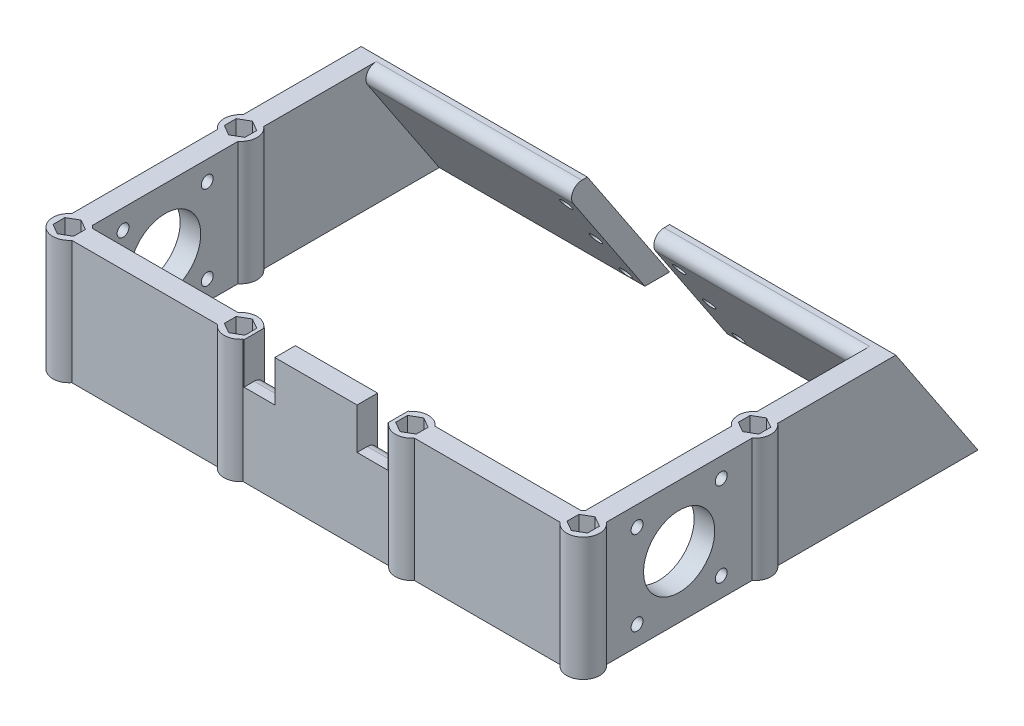
from build123d import *
from OCP.BRepFilletAPI import BRepFilletAPI_MakeChamfer

# Parameters (mm, degrees)
BOSS_EXTRUDE2_DEPTH     = 38.1
CHAMFER2_SIZE           = 38.1
CHAMFER2_SIZE_2         = 25.4
SKETCH6_W               = 9.525
SKETCH6_H               = 12.7
CUT_EXTRUDE3_DEPTH      = 206.929041238
SKETCH7_R               = 10.9855
SKETCH7_R_2             = 1.8415
CUT_EXTRUDE4_DEPTH      = 207.992468583
SKETCH8_W               = 69.85
SKETCH8_H               = 45.790501198
BOSS_EXTRUDE3_DEPTH     = 6.35
CUT_EXTRUDE5_DEPTH      = 208.669669805
CUT_EXTRUDE5_DEPTH_BACK = 208.669669805
BOSS_EXTRUDE4_DEPTH     = 69.85
BOSS_EXTRUDE5_DEPTH     = 69.85
SKETCH12_R              = 1.8288
CUT_EXTRUDE6_DEPTH      = 210.393754689
SKETCH13_R              = 1.8288
CUT_EXTRUDE7_DEPTH      = 12.7
FILLET1_R               = 3.175


with BuildPart() as part:
    # Sketch4 → Boss-Extrude2 (new body)
    with BuildSketch(Plane(origin=(0, 0, 0), x_dir=(1, 0, 0), z_dir=(0, 1, 0))):
        with BuildLine():
            Line((0, 0), (0, -54.242759604))
            ThreePointArc((0, -54.242759604), (-1.905, -58.208333333), (0, -62.173907062))
            Line((0, -62.173907062), (0, -107.159426271))
            ThreePointArc((0, -107.159426271), (-0.417102448, -114.717102448), (7.140573729, -114.3))
            Line((7.140573729, -114.3), (52.126092938, -114.3))
            ThreePointArc((52.126092938, -114.3), (56.091666667, -116.205), (60.057240396, -114.3))
            Line((60.057240396, -114.3), (105.042759604, -114.3))
            ThreePointArc((105.042759604, -114.3), (109.008333333, -116.205), (112.973907062, -114.3))
            Line((112.973907062, -114.3), (157.959426271, -114.3))
            ThreePointArc((157.959426271, -114.3), (165.517102448, -114.717102448), (165.1, -107.159426271))
            Line((165.1, -107.159426271), (165.1, -62.173907062))
            ThreePointArc((165.1, -62.173907062), (167.005, -58.208333333), (165.1, -54.242759604))
            Line((165.1, -54.242759604), (165.1, 0))
            Line((165.1, 0), (158.75, 0))
            Line((158.75, 0), (158.75, -54.242759604))
            ThreePointArc((158.75, -54.242759604), (156.845, -58.208333333), (158.75, -62.173907062))
            Line((158.75, -62.173907062), (158.75, -107.159426271))
            ThreePointArc((158.75, -107.159426271), (158.332897552, -107.532897552), (157.959426271, -107.95))
            Line((157.959426271, -107.95), (112.973907062, -107.95))
            ThreePointArc((112.973907062, -107.95), (109.008333333, -106.045), (105.042759604, -107.95))
            Line((105.042759604, -107.95), (60.057240396, -107.95))
            ThreePointArc((60.057240396, -107.95), (56.091666667, -106.045), (52.126092938, -107.95))
            Line((52.126092938, -107.95), (7.140573729, -107.95))
            ThreePointArc((7.140573729, -107.95), (6.767102448, -107.532897552), (6.35, -107.159426271))
            Line((6.35, -107.159426271), (6.35, -62.173907062))
            ThreePointArc((6.35, -62.173907062), (8.255, -58.208333333), (6.35, -54.242759604))
            Line((6.35, -54.242759604), (6.35, 0))
            Line((6.35, 0), (0, 0))
        make_face()
        Polygon((0, -56.375246229), (0, -60.041420438), (3.175, -61.874507543), (6.35, -60.041420438), (6.35, -56.375246229), (3.175, -54.542159124), align=None, mode=Mode.SUBTRACT)
        Polygon((3.175, -107.458825791), (0, -109.291912895), (0, -112.958087105), (3.175, -114.791174209), (6.35, -112.958087105), (6.35, -109.291912895), align=None, mode=Mode.SUBTRACT)
        Polygon((56.091666667, -107.458825791), (52.916666667, -109.291912895), (52.916666667, -112.958087105), (56.091666667, -114.791174209), (59.266666667, -112.958087105), (59.266666667, -109.291912895), align=None, mode=Mode.SUBTRACT)
        Polygon((109.008333333, -107.458825791), (105.833333333, -109.291912895), (105.833333333, -112.958087105), (109.008333333, -114.791174209), (112.183333333, -112.958087105), (112.183333333, -109.291912895), align=None, mode=Mode.SUBTRACT)
        Polygon((161.925, -107.458825791), (158.75, -109.291912895), (158.75, -112.958087105), (161.925, -114.791174209), (165.1, -112.958087105), (165.1, -109.291912895), align=None, mode=Mode.SUBTRACT)
        Polygon((161.925, -54.542159124), (158.75, -56.375246229), (158.75, -60.041420438), (161.925, -61.874507543), (165.1, -60.041420438), (165.1, -56.375246229), align=None, mode=Mode.SUBTRACT)
    extrude(amount=BOSS_EXTRUDE2_DEPTH)

    # Chamfer2
    chamfer2_edges_1 = [part.edges().sort_by_distance(p)[0] for p in [
        (161.925, 38.1, 0),
    ]]
    chamfer2_side_1 = [part.faces().sort_by_distance(p)[0] for p in [
        (161.925, 37.592, 0),
    ]]
    chamfer2_edges_2 = [part.edges().sort_by_distance(p)[0] for p in [
        (3.175, 38.1, 0),
    ]]
    chamfer2_side_2 = [part.faces().sort_by_distance(p)[0] for p in [
        (3.175, 37.592, 0),
    ]]
    chamfer2 = BRepFilletAPI_MakeChamfer(part.part.solid().wrapped)
    for e in chamfer2_edges_1:
        chamfer2.Add(CHAMFER2_SIZE - 0.0001, CHAMFER2_SIZE_2 - 0.0001, e.wrapped, chamfer2_side_1[0].wrapped)
    for e in chamfer2_edges_2:
        chamfer2.Add(CHAMFER2_SIZE - 0.0001, CHAMFER2_SIZE_2 - 0.0001, e.wrapped, chamfer2_side_2[0].wrapped)
    add(Compound.cast(chamfer2.Shape()), mode=Mode.REPLACE)  # a hair under: the kernel refuses the full size

    # Sketch6 → Cut-Extrude3 (cut, through all)
    with BuildSketch(Plane.XY.offset(114.3)):
        with Locations((65.0875, 31.75)):
            Rectangle(SKETCH6_W, SKETCH6_H)
        with Locations((100.0125, 31.75)):
            Rectangle(SKETCH6_W, SKETCH6_H)
    extrude(amount=-CUT_EXTRUDE3_DEPTH, mode=Mode.SUBTRACT)

    # Sketch7 → Cut-Extrude4 (cut, through all)
    with BuildSketch(Plane(origin=(165.1, 0, 0), x_dir=(0, 0, -1), z_dir=(1, 0, 0))):
        with Locations((-84.666666667, 19.05)):
            Circle(SKETCH7_R)
        with Locations((-71.666666667, 32.05)):
            Circle(SKETCH7_R_2)
        with Locations((-71.666666667, 6.05)):
            Circle(SKETCH7_R_2)
        with Locations((-97.666666667, 6.05)):
            Circle(SKETCH7_R_2)
        with Locations((-97.666666667, 32.05)):
            Circle(SKETCH7_R_2)
    extrude(amount=-CUT_EXTRUDE4_DEPTH, mode=Mode.SUBTRACT)

    # Sketch8 → Boss-Extrude3 (add)
    with BuildSketch(Plane(origin=(0, 0, 0), x_dir=(-1, 0, 0), z_dir=(0, 0.5547001962252279, -0.8320502943378446))):
        with Locations((-130.175, 22.895250599)):
            Rectangle(SKETCH8_W, SKETCH8_H)
        with Locations((-34.925, 22.895250599)):
            Rectangle(SKETCH8_W, SKETCH8_H)
    extrude(amount=BOSS_EXTRUDE3_DEPTH)

    # Sketch9 → Cut-Extrude5 (cut, two sides: drawn at the far end of the back side and taken through both)
    with BuildSketch(Plane(origin=(165.1, 0, 0), x_dir=(0, 0, -1), z_dir=(1, 0, 0)).offset(-CUT_EXTRUDE5_DEPTH_BACK)):
        Polygon((-25.4, 38.1), (-17.7682498, 38.1), (-20.116480631, 41.622346246), align=None)
    extrude(amount=CUT_EXTRUDE5_DEPTH + CUT_EXTRUDE5_DEPTH_BACK, mode=Mode.SUBTRACT)

    # Sketch10 → Boss-Extrude4 (add)
    with BuildSketch(Plane(origin=(165.1, 0, 0), x_dir=(0, 0, -1), z_dir=(1, 0, 0))):
        Polygon((0, 0), (7.6317502, 0), (5.283519369, 3.522346246), align=None)
    extrude(amount=-BOSS_EXTRUDE4_DEPTH)

    # Sketch11 → Boss-Extrude5 (add)
    with BuildSketch(Plane.ZY):
        Polygon((-5.283519369, 3.522346246), (-7.6317502, 0), (0, 0), align=None)
    extrude(amount=-BOSS_EXTRUDE5_DEPTH)

    # Sketch12 → Cut-Extrude6 (cut, through all)
    with BuildSketch(Plane(origin=(0, 3.522346246, -5.283519369), x_dir=(-1, 0, 0), z_dir=(0, 0.5547001962252279, -0.8320502943378446))):
        with Locations(Location((-65.0875, 35.207167865, 0), (0, 0, 90))):
            Circle(SKETCH12_R)
        with Locations(Location((-65.0875, 2.116666667, 0), (0, 0, 90))):
            Circle(SKETCH12_R)
        with Locations(Location((-100.0125, 35.207167865, 0), (0, 0, 90))):
            Circle(SKETCH12_R)
        with Locations(Location((-100.0125, 2.116666667, 0), (0, 0, 90))):
            Circle(SKETCH12_R)
    extrude(amount=-CUT_EXTRUDE6_DEPTH, mode=Mode.SUBTRACT)

    # Sketch13 → Cut-Extrude7 (cut)
    with BuildSketch(Plane(origin=(0, 3.522346246, -5.283519369), x_dir=(-1, 0, 0), z_dir=(0, 0.5547001962252279, -0.8320502943378446))):
        with Locations(Location((-161.925, 35.207167865, 0), (0, 0, 90))):
            Circle(SKETCH13_R)
        with Locations(Location((-161.925, 18.661917266, 0), (0, 0, 90))):
            Circle(SKETCH13_R)
        with Locations(Location((-100.0125, 18.661917266, 0), (0, 0, 90))):
            Circle(SKETCH13_R)
        with Locations(Location((-3.175, 18.661917266, 0), (0, 0, 270))):
            Circle(SKETCH13_R)
        with Locations(Location((-3.175, 35.207167865, 0), (0, 0, 270))):
            Circle(SKETCH13_R)
        with Locations(Location((-65.0875, 18.661917266, 0), (0, 0, 270))):
            Circle(SKETCH13_R)
    extrude(amount=-CUT_EXTRUDE7_DEPTH, mode=Mode.SUBTRACT)

    # Fillet1
    fillet1_edges = [part.edges().sort_by_distance(p)[0] for p in [
        (100.0125, 25.4, 107.95),
        (65.0875, 25.4, 107.95),
        (127, 38.1, 25.4),
        (38.1, 38.1, 25.4),
    ]]
    fillet(fillet1_edges, radius=FILLET1_R)


solid = part.part
